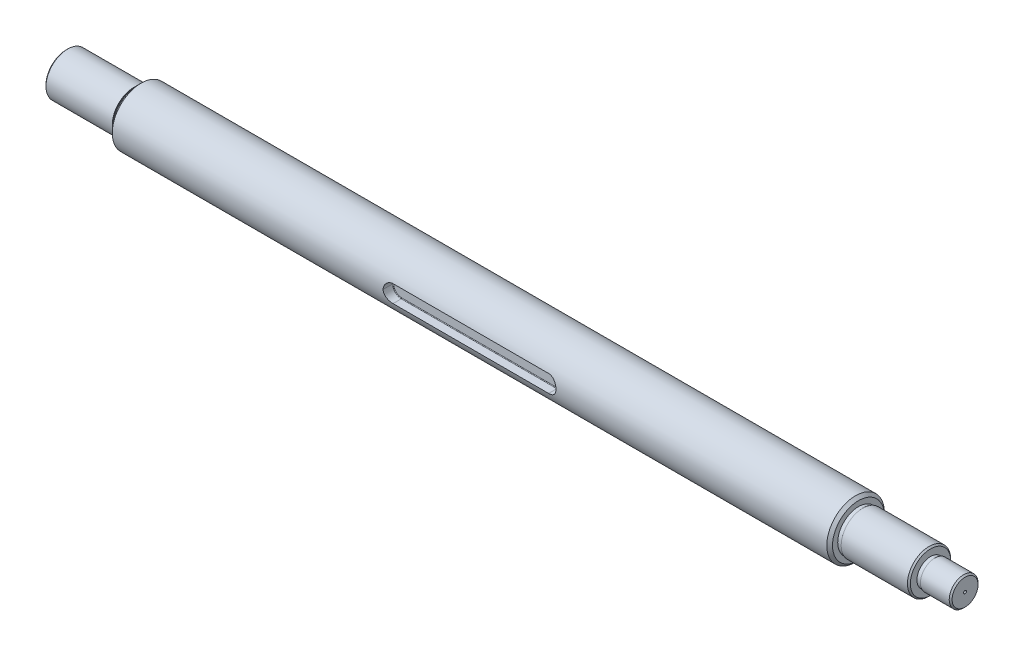
from build123d import *

# Parameters (mm, degrees)
CHAMFER1_SIZE      = 0.5
SKETCH3_W          = 1.5
SKETCH3_H          = 0.3
SKETCH9_W          = 60
SKETCH9_H          = 6
CUT_EXTRUDE2_DEPTH = 3.5
FILLET4_R          = 3
FILLET5_R          = 3
FILLET6_R          = 0.2


with BuildPart() as part:
    # Sketch1 → Revolve1 (revolve)
    with BuildSketch(Plane.XY, mode=Mode.PRIVATE) as revolve1_sk:
        Polygon((0, 0), (0, 7.5), (25, 7.5), (25, 9), (26, 10), (274, 10), (275, 9), (275, 7.5), (300, 7.5), (300, 5), (312, 5), (312, 0), align=None)
    revolve(revolve1_sk.sketch.rotate(Axis((0, 0, 0), (1, 0, 0)), 90), axis=Axis((0, 0, 0), (1, 0, 0)))

    # Chamfer1
    chamfer1_edges = [part.edges().sort_by_distance(p)[0] for p in [
        (300, 0, -7.5),
        (312, 0, -5),
        (0, 0, -7.5),
    ]]
    chamfer(chamfer1_edges, length=CHAMFER1_SIZE)

    # Sketch2 → Cut-Revolve1 (revolve, cut)
    with BuildSketch(Plane.XY, mode=Mode.PRIVATE) as cut_revolve1_sk:
        Polygon((0, 0), (0, 0.5), (0.5, 0), align=None)
        Polygon((312, 0), (312, 0.5), (311.5, 0), align=None)
    revolve(cut_revolve1_sk.sketch.rotate(Axis((0, 0, 0), (1, 0, 0)), 270), axis=Axis((0, 0, 0), (1, 0, 0)), mode=Mode.SUBTRACT)

    # Sketch3 → Cut-Revolve2 (revolve, cut)
    with BuildSketch(Plane.XY, mode=Mode.PRIVATE) as cut_revolve2_sk:
        with Locations((24.25, 7.35)):
            Rectangle(SKETCH3_W, SKETCH3_H)
        with Locations((275.75, 7.35)):
            Rectangle(SKETCH3_W, SKETCH3_H)
        with Locations((300.75, 4.85)):
            Rectangle(SKETCH3_W, SKETCH3_H)
    revolve(cut_revolve2_sk.sketch.rotate(Axis((0, 0, 0), (1, 0, 0)), 90), axis=Axis((0, 0, 0), (1, 0, 0)), mode=Mode.SUBTRACT)

    # Sketch9 → Cut-Extrude2 (cut)
    with BuildSketch(Plane.XY.offset(10)):
        with Locations((150, 0)):
            Rectangle(SKETCH9_W, SKETCH9_H)
    extrude(amount=-CUT_EXTRUDE2_DEPTH, mode=Mode.SUBTRACT)

    # Fillet4
    fillet4_edges = [part.edges().sort_by_distance(p)[0] for p in [
        (120, 3, 8.019696007),
        (120, -3, 8.019696007),
    ]]
    fillet(fillet4_edges, radius=FILLET4_R - 0.0001)  # a hair under: the kernel refuses the full size

    # Fillet5
    fillet5_edges = [part.edges().sort_by_distance(p)[0] for p in [
        (180, 3, 8.019696007),
        (180, -3, 8.019696007),
    ]]
    fillet(fillet5_edges, radius=FILLET5_R - 0.0001)  # a hair under: the kernel refuses the full size

    # Fillet6
    fillet6_edges = [part.edges().sort_by_distance(p)[0] for p in [
        (150, -3, 6.5),
        (120.878650367, -2.121349633, 6.5),
        (120.878650367, 2.121349633, 6.5),
        (150, 3, 6.5),
        (179.121349633, -2.121349633, 6.5),
        (179.121349633, 2.121349633, 6.5),
    ]]
    fillet(fillet6_edges, radius=FILLET6_R)


solid = part.part
